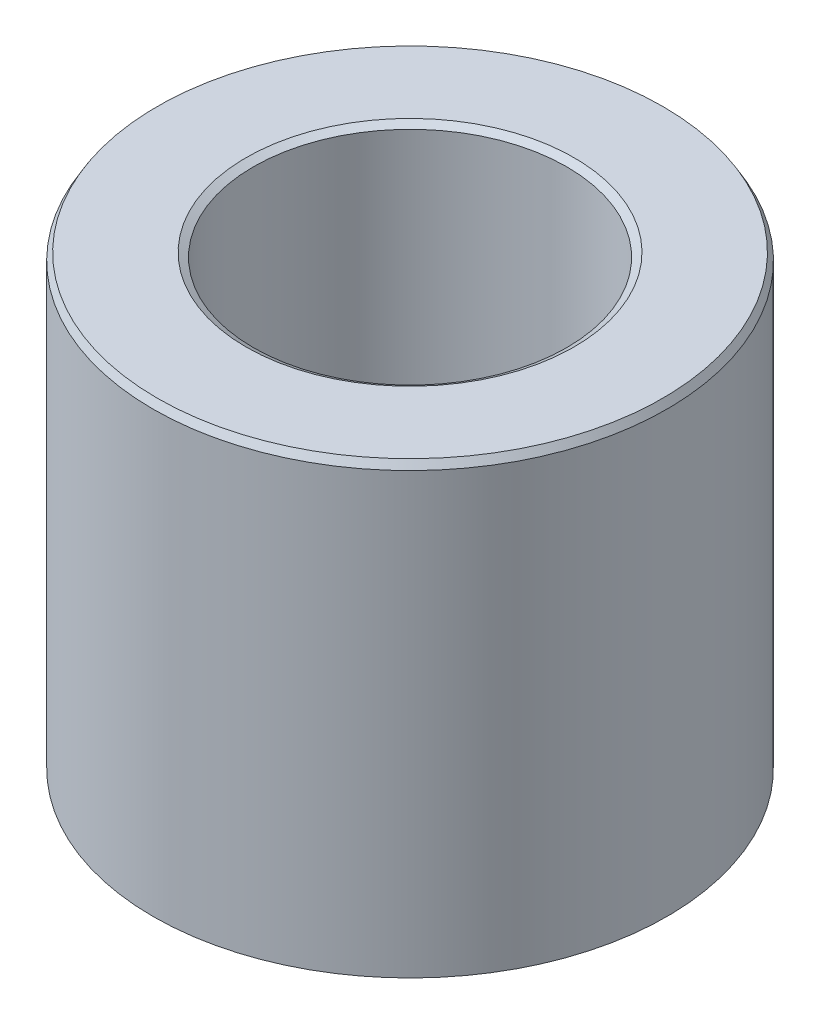
from build123d import *
from OCP.BRepFilletAPI import BRepFilletAPI_MakeChamfer

# Parameters (mm, degrees)
SKETCH1_R           = 57.5
BOSS_EXTRUDE1_DEPTH = 100.914058663
SKETCH2_R           = 35.060213503
CUT_EXTRUDE1_DEPTH  = 130.599950755
CHAMFER1_SIZE       = 1.641602872
CHAMFER1_SIZE2      = 0.94777986


with BuildPart() as part:
    # Sketch1 → Boss-Extrude1 (new body)
    with BuildSketch(Plane(origin=(0, 0, 0), x_dir=(1, 0, 0), z_dir=(0, 1, 0))):
        Circle(SKETCH1_R)
    extrude(amount=BOSS_EXTRUDE1_DEPTH)

    # Sketch2 → Cut-Extrude1 (cut, through all)
    with BuildSketch(Plane(origin=(0, 0, 0), x_dir=(1, 0, 0), z_dir=(0, 1, 0))):
        Circle(SKETCH2_R)
    extrude(amount=CUT_EXTRUDE1_DEPTH, mode=Mode.SUBTRACT)

    # Chamfer1: one chamfer whose edges measure the first distance from different faces: ONE call of the kernel's chamfer builder (chamfer() names one face for all edges)
    chamfer1_edges_1 = [part.edges().sort_by_distance(p)[0] for p in [
        (-35.060213503, 100.914058663, 0),
    ]]
    chamfer1_side_1 = [part.faces().sort_by_distance(p)[0] for p in [
        (-55.873654403, 100.914058663, 0),
    ]]
    chamfer1_edges_2 = [part.edges().sort_by_distance(p)[0] for p in [
        (-35.060213503, 0, 0),
    ]]
    chamfer1_side_2 = [part.faces().sort_by_distance(p)[0] for p in [
        (-35.060213503, 50.457029331, 0),
    ]]
    chamfer1_edges_3 = [part.edges().sort_by_distance(p)[0] for p in [
        (-57.5, 0, 0),
    ]]
    chamfer1_side_3 = [part.faces().sort_by_distance(p)[0] for p in [
        (-55.873654403, 0, 0),
    ]]
    chamfer1_edges_4 = [part.edges().sort_by_distance(p)[0] for p in [
        (-57.5, 100.914058663, 0),
    ]]
    chamfer1_side_4 = [part.faces().sort_by_distance(p)[0] for p in [
        (-57.5, 50.457029331, 0),
    ]]
    chamfer1 = BRepFilletAPI_MakeChamfer(part.part.solid().wrapped)
    for e in chamfer1_edges_1:
        chamfer1.Add(CHAMFER1_SIZE, CHAMFER1_SIZE2, e.wrapped, chamfer1_side_1[0].wrapped)  # the first distance lies on this face
    for e in chamfer1_edges_2:
        chamfer1.Add(CHAMFER1_SIZE, CHAMFER1_SIZE2, e.wrapped, chamfer1_side_2[0].wrapped)  # the first distance lies on this face
    for e in chamfer1_edges_3:
        chamfer1.Add(CHAMFER1_SIZE, CHAMFER1_SIZE2, e.wrapped, chamfer1_side_3[0].wrapped)  # the first distance lies on this face
    for e in chamfer1_edges_4:
        chamfer1.Add(CHAMFER1_SIZE, CHAMFER1_SIZE2, e.wrapped, chamfer1_side_4[0].wrapped)  # the first distance lies on this face
    add(Compound.cast(chamfer1.Shape()), mode=Mode.REPLACE)


solid = part.part
